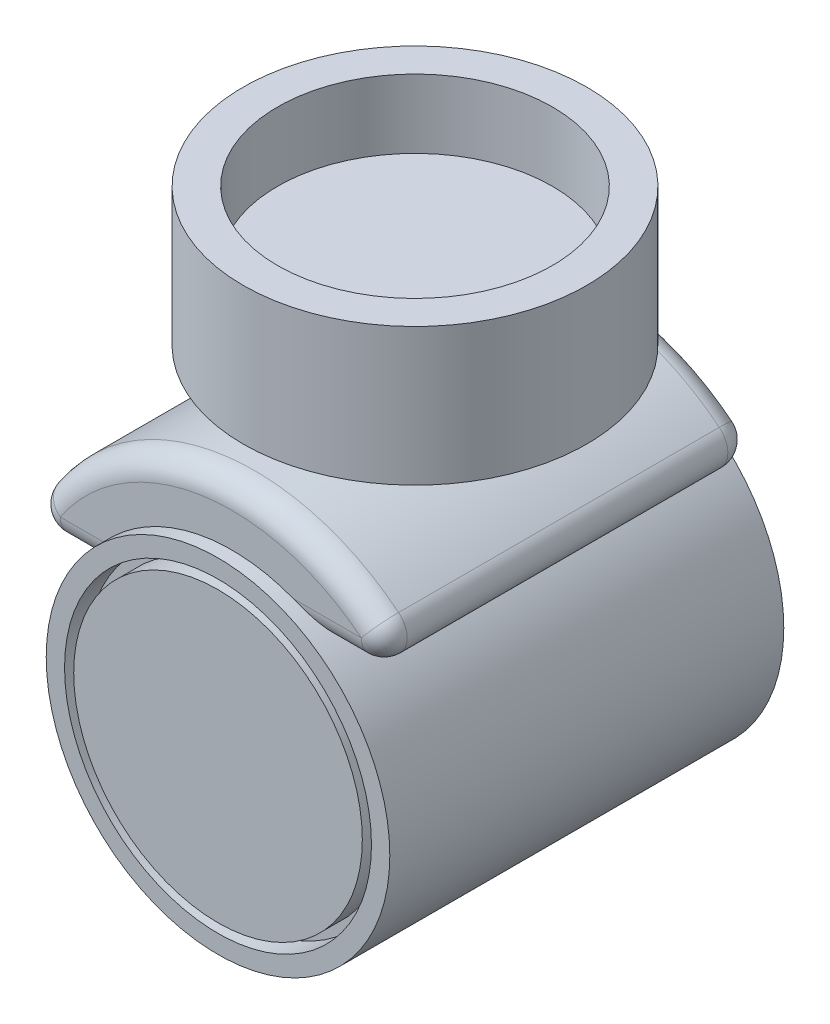
from build123d import *

# Parameters (mm, degrees)
SKETCH1_R                = 2.54
BOSS_EXTRUDE1_DEPTH      = 1.27
SKETCH2_R                = 3.175
SKETCH2_R_2              = 2.54
BOSS_EXTRUDE2_DEPTH      = 2.54
SKETCH3_R                = 0.9525
CUT_EXTRUDE1_DEPTH       = 0.3175
SCALE1_SCALE             = 1.5
FILLET1_R                = 0.635
SKETCH5_R                = 1.42875
BOSS_EXTRUDE3_DEPTH      = 1.905
BOSS_EXTRUDE4_DEPTH      = 5.08
BOSS_EXTRUDE4_DEPTH_BACK = 5.08
FILLET2_R                = 0.635
BOSS_EXTRUDE5_DEPTH      = 5.461
BOSS_EXTRUDE5_DEPTH_BACK = 5.461
SKETCH9_R                = 4.7625
SKETCH10_R               = 4.2545
SKETCH10_R_2             = 4.0005
CUT_EXTRUDE3_DEPTH       = 0.635
FILLET3_R                = 0.635


with BuildPart() as part:
    # Sketch1 → Boss-Extrude1 (new body)
    with BuildSketch(Plane(origin=(0, 0, 0), x_dir=(1, 0, 0), z_dir=(0, 1, 0))):
        with Locations(Location((0, 0, 0), (0, 0, 270))):
            Circle(SKETCH1_R)
    extrude(amount=BOSS_EXTRUDE1_DEPTH)

    # Sketch2 → Boss-Extrude2 (add)
    with BuildSketch(Plane(origin=(0, 0, 0), x_dir=(1, 0, 0), z_dir=(0, 1, 0))):
        with Locations(Location((0, 0, 0), (0, 0, 270))):
            Circle(SKETCH2_R)
        with Locations(Location((0, 0, 0), (0, 0, 270))):
            Circle(SKETCH2_R_2, mode=Mode.SUBTRACT)
    extrude(amount=BOSS_EXTRUDE2_DEPTH)

    # Sketch3 → Cut-Extrude1 (cut)
    with BuildSketch(Plane.XZ):
        with Locations(Location((0, 0, 0), (0, 0, 270))):
            Circle(SKETCH3_R)
    extrude(amount=-CUT_EXTRUDE1_DEPTH, mode=Mode.SUBTRACT)


with BuildPart() as part_1:
    # Scale1: scaled about (0, 0.984843458, 0)
    add(part.part.scale(SCALE1_SCALE).moved(Location((0, -0.492421729, 0))))

    # Fillet1
    # the kernel refuses this fillet: 0.635 mm, written as the material it takes off along each edge
    with BuildSketch(Plane(origin=(0, -0.492421729, 0), x_dir=(0, 0, -1), z_dir=(-1, 0, 0))) as fillet1_piece_1:
        with BuildLine():
            CenterArc((2.043586106, -0.635), FILLET1_R, 90, 75.522487814)
            Line((1.42875, -0.47625), (1.416453278, -0.473075))
            ThreePointArc((1.416453278, -0.473075), (1.41605, -0.238125), (1.41605, 0))
            Line((1.41605, 0), (1.42875, 0.0127))
            Line((1.42875, 0.0127), (2.043586106, 0.0127))
            Line((2.043586106, 0.0127), (2.043586106, 0))
        make_face()
    revolve(axis=Axis((0, -0.492421729, 0), (0, -1, 0)), mode=Mode.SUBTRACT)

    # Sketch5 → Boss-Extrude3 (add)
    with BuildSketch(Plane.XZ.offset(0.016171729)):
        with Locations(Location((0, 0, 0), (0, 0, 90))):
            Circle(SKETCH5_R)
    extrude(amount=BOSS_EXTRUDE3_DEPTH)

    # Sketch7 → Boss-Extrude4 (add, two sides: drawn at the far end of the back side and taken through both)
    with BuildSketch(Plane.XY.offset(-BOSS_EXTRUDE4_DEPTH_BACK)):
        with BuildLine():
            Line((5.08, -3.826171729), (2.8575, -3.826171729))
            ThreePointArc((2.8575, -3.826171729), (-0.863775136, -2.952658223), (-4.028623369, -5.096171729))
            Line((-4.028623369, -5.096171729), (-5.819871133, -5.096171729))
            ThreePointArc((-5.819871133, -5.096171729), (-0.734899533, -1.328840861), (5.08, -3.826171729))
        make_face()
    extrude(amount=BOSS_EXTRUDE4_DEPTH + BOSS_EXTRUDE4_DEPTH_BACK)

    # Fillet2
    fillet2_edges = [part_1.edges().sort_by_distance(p)[0] for p in [
        (-5.819871133, -5.096171729, 0),
        (5.08, -3.826171729, 0),
        (2.8575, -3.826171729, 0),
        (-4.028623369, -5.096171729, 0),
    ]]
    fillet(fillet2_edges, radius=FILLET2_R)

    # Sketch9 → Boss-Extrude5 (add, two sides: drawn at the far end of the back side and taken through both)
    with BuildSketch(Plane.XY.offset(-BOSS_EXTRUDE5_DEPTH_BACK)):
        with Locations((0, -7.636171729)):
            Circle(SKETCH9_R)
    extrude(amount=BOSS_EXTRUDE5_DEPTH + BOSS_EXTRUDE5_DEPTH_BACK)

    # Sketch10 → Cut-Extrude3 (cut)
    with BuildSketch(Plane(origin=(0, 0, -5.461), x_dir=(-1, 0, 0), z_dir=(0, 0, -1))):
        with Locations((0, -7.636171729)):
            Circle(SKETCH10_R)
        with Locations((0, -7.636171729)):
            Circle(SKETCH10_R_2, mode=Mode.SUBTRACT)
    cut_extrude3 = extrude(amount=-CUT_EXTRUDE3_DEPTH, mode=Mode.SUBTRACT)

    # Mirror1: Cut-Extrude3 across plane
    add(cut_extrude3.mirror(Plane.XY), mode=Mode.SUBTRACT)

    # Fillet3
    # the kernel refuses this fillet: 0.635 mm, written as the material it takes off along each edge
    with BuildSketch(Plane(origin=(3.592102448, -3.826171729, 5.08), x_dir=(0, 1, 0), z_dir=(-1, 0, 0))) as fillet3_piece_1_section:
        with BuildLine():
            CenterArc((FILLET3_R, FILLET3_R), FILLET3_R, 180, 90)
            Line((0, FILLET3_R), (0, 0))
            Line((0, 0), (FILLET3_R, 0))
        make_face()
    fillet3_piece_1 = extrude(amount=2.117743332, mode=Mode.PRIVATE)
    fillet3_piece_1 = fillet3_piece_1 - Plane(origin=(0, -7.636171729, 5.008990652), x_dir=(1, 0, 0), z_dir=(0, 0, -1)) * Cylinder(4.7625, 7, mode=Mode.PRIVATE)
    add(fillet3_piece_1, mode=Mode.SUBTRACT)
    with BuildSketch(Plane(origin=(3.592102448, -3.191171729, 5.08), x_dir=(0.6285393610547108, 0.7777777777777762, 0), z_dir=(-0.7777777777777762, 0.6285393610547108, 0))) as fillet3_piece_2:
        with BuildLine():
            CenterArc((0.635 - FILLET3_R, FILLET3_R), FILLET3_R, 270, 90)
            Line((0.635, FILLET3_R), (0.635, 0))
            Line((0.635, 0), (0.635 - FILLET3_R, 0))
        make_face()
    revolve(axis=Axis((3.592102448, -3.191171729, 5.08), (0, 0, -1)), revolution_arc=141.057558731, mode=Mode.SUBTRACT)
    with BuildSketch(Plane(origin=(-2.777403349, -5.096171729, 5.08), x_dir=(0, 1, 0), z_dir=(-1, 0, 0))) as fillet3_piece_3_section:
        with BuildLine():
            CenterArc((FILLET3_R, FILLET3_R), FILLET3_R, 180, 90)
            Line((0, FILLET3_R), (0, 0))
            Line((0, 0), (FILLET3_R, 0))
        make_face()
    fillet3_piece_3 = extrude(amount=1.974501532, mode=Mode.PRIVATE)
    fillet3_piece_3 = fillet3_piece_3 - Plane(origin=(0, -7.636171729, 4.983808313), x_dir=(1, 0, 0), z_dir=(0, 0, -1)) * Cylinder(4.7625, 7, mode=Mode.PRIVATE)
    add(fillet3_piece_3, mode=Mode.SUBTRACT)
    with BuildSketch(Plane(origin=(-4.751904881, -4.461171729, 5.08), x_dir=(-0.8314794192830989, 0.5555555555555544, 0), z_dir=(0.5555555555555544, 0.8314794192830989, 0))) as fillet3_piece_4:
        with BuildLine():
            CenterArc((0.635 - FILLET3_R, -FILLET3_R), FILLET3_R, 0, 90)
            Line((0.635, -FILLET3_R), (0.635, 0))
            Line((0.635, 0), (0.635 - FILLET3_R, 0))
        make_face()
    revolve(axis=Axis((-4.751904881, -4.461171729, 5.08), (0, 0, 1)), revolution_arc=123.748988596, mode=Mode.SUBTRACT)
    with BuildSketch(Plane(origin=(3.592102448, -3.826171729, -5.08), x_dir=(0, 1, 0), z_dir=(-1, 0, 0))) as fillet3_piece_5_section:
        with BuildLine():
            CenterArc((FILLET3_R, -FILLET3_R), FILLET3_R, 90, 90)
            Line((0, -FILLET3_R), (0, 0))
            Line((0, 0), (FILLET3_R, 0))
        make_face()
    fillet3_piece_5 = extrude(amount=2.117743332, mode=Mode.PRIVATE)
    fillet3_piece_5 = fillet3_piece_5 - Plane(origin=(0, -7.636171729, -5.008990652), x_dir=(1, 0, 0), z_dir=(0, 0, -1)) * Cylinder(4.7625, 7, mode=Mode.PRIVATE)
    add(fillet3_piece_5, mode=Mode.SUBTRACT)
    with BuildSketch(Plane(origin=(3.592102448, -3.191171729, -5.08), x_dir=(0.6285393610547108, 0.7777777777777762, 0), z_dir=(-0.7777777777777762, 0.6285393610547108, 0))) as fillet3_piece_6:
        with BuildLine():
            CenterArc((0.635 - FILLET3_R, -FILLET3_R), FILLET3_R, 0, 90)
            Line((0.635 - FILLET3_R, 0), (0.635, 0))
            Line((0.635, 0), (0.635, -FILLET3_R))
        make_face()
    revolve(axis=Axis((3.592102448, -3.191171729, -5.08), (0, 0, -1)), revolution_arc=141.057558731, mode=Mode.SUBTRACT)
    with BuildSketch(Plane(origin=(-2.777403349, -5.096171729, -5.08), x_dir=(0, 1, 0), z_dir=(-1, 0, 0))) as fillet3_piece_7_section:
        with BuildLine():
            CenterArc((FILLET3_R, -FILLET3_R), FILLET3_R, 90, 90)
            Line((0, -FILLET3_R), (0, 0))
            Line((0, 0), (FILLET3_R, 0))
        make_face()
    fillet3_piece_7 = extrude(amount=1.974501532, mode=Mode.PRIVATE)
    fillet3_piece_7 = fillet3_piece_7 - Plane(origin=(0, -7.636171729, -4.983808313), x_dir=(1, 0, 0), z_dir=(0, 0, -1)) * Cylinder(4.7625, 7, mode=Mode.PRIVATE)
    add(fillet3_piece_7, mode=Mode.SUBTRACT)
    with BuildSketch(Plane(origin=(-4.751904881, -4.461171729, -5.08), x_dir=(-0.8314794192830989, 0.5555555555555544, 0), z_dir=(0.5555555555555544, 0.8314794192830989, 0))) as fillet3_piece_8:
        with BuildLine():
            CenterArc((0.635 - FILLET3_R, FILLET3_R), FILLET3_R, 270, 90)
            Line((0.635 - FILLET3_R, 0), (0.635, 0))
            Line((0.635, 0), (0.635, FILLET3_R))
        make_face()
    revolve(axis=Axis((-4.751904881, -4.461171729, -5.08), (0, 0, 1)), revolution_arc=123.748988596, mode=Mode.SUBTRACT)
    with BuildSketch(Plane(origin=(0, -7.636171729, 5.08), x_dir=(-0.8314794192830981, 0.5555555555555554, 0), z_dir=(-0.5555555555555554, -0.8314794192830981, 0))) as fillet3_piece_9:
        with BuildLine():
            CenterArc((6.35 - FILLET3_R, FILLET3_R), FILLET3_R, 270, 90)
            Line((6.35 - FILLET3_R, 0), (6.35, 0))
            Line((6.35, 0), (6.35, FILLET3_R))
        make_face()
    revolve(axis=Axis((0, -7.636171729, 5.08), (0, 0, -1)), revolution_arc=95.193452673, mode=Mode.SUBTRACT)
    with BuildSketch(Plane(origin=(0, -7.636171729, -5.08), x_dir=(-0.8314794192830981, 0.5555555555555554, 0), z_dir=(-0.5555555555555554, -0.8314794192830981, 0))) as fillet3_piece_10:
        with BuildLine():
            CenterArc((6.35 - FILLET3_R, -FILLET3_R), FILLET3_R, 0, 90)
            Line((6.35 - FILLET3_R, 0), (6.35, 0))
            Line((6.35, 0), (6.35, -FILLET3_R))
        make_face()
    revolve(axis=Axis((0, -7.636171729, -5.08), (0, 0, -1)), revolution_arc=95.193452673, mode=Mode.SUBTRACT)


solid = part_1.part
